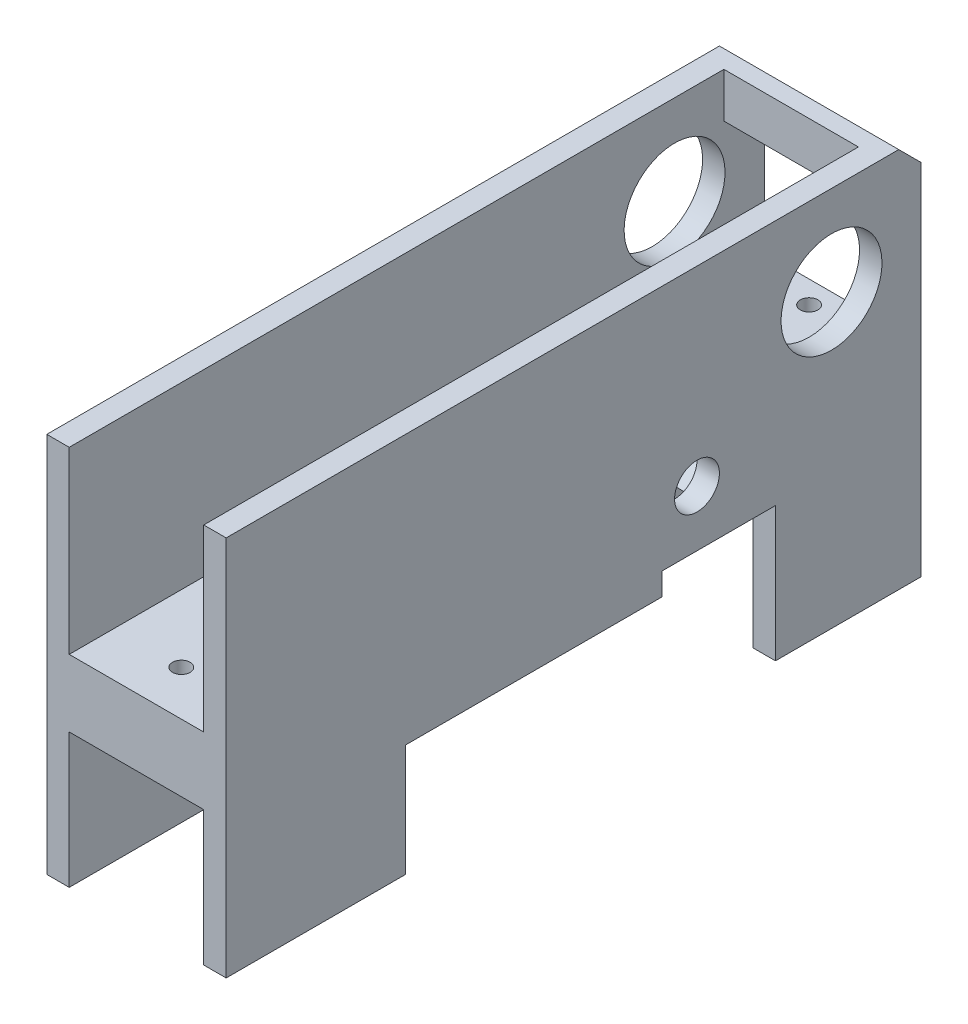
from build123d import *

# Parameters (mm, degrees)
BOSS_EXTRUDE1_DEPTH = 25.4
SKETCH2_R           = 14.2875
CUT_EXTRUDE1_DEPTH  = 83.854726027
SKETCH3_W           = 50.8
SKETCH3_H           = 38.1
CUT_EXTRUDE3_DEPTH  = 9.525
SKETCH4_W           = 11.43
SKETCH4_H           = 12.7
BOSS_EXTRUDE2_DEPTH = 38.1
CHAMFER1_SIZE       = 6.35
SKETCH5_W           = 6.35
SKETCH5_H           = 69.85
BOSS_EXTRUDE3_DEPTH = 95.25
SKETCH7_R           = 6.35
CUT_EXTRUDE5_DEPTH  = 145.139405178
SKETCH8_W           = 38.1
SKETCH8_H           = 9.525
CUT_EXTRUDE6_DEPTH  = 9.525
CHAMFER4_SIZE       = 9.525
SKETCH10_W          = 50.8
SKETCH10_H          = 72.641150816
BOSS_EXTRUDE5_DEPTH = 6.35
BOSS_EXTRUDE9_DEPTH = 50.8
SKETCH13_W          = 38.1
SKETCH13_H          = 50.8
CUT_EXTRUDE8_DEPTH  = 6.3754
SKETCH14_R          = 2.4892
CUT_EXTRUDE9_DEPTH  = 19.05
SKETCH15_R          = 2.4892
CUT_EXTRUDE10_DEPTH = 19.0246


with BuildPart() as part:
    # Sketch1 → Boss-Extrude1 (new, symmetric)
    with BuildSketch(Plane.XY):
        Polygon((-25.4, -47.625), (-19.05, -47.625), (-19.05, -9.525), (19.05, -9.525), (19.05, -47.625), (25.4, -47.625), (25.4, 60.325), (19.05, 60.325), (19.05, 9.525), (-19.05, 9.525), (-19.05, 60.325), (-25.4, 60.325), align=None)
    extrude(amount=BOSS_EXTRUDE1_DEPTH, both=True)

    # Sketch2 → Cut-Extrude1 (cut, through all)
    with BuildSketch(Plane.ZY.offset(25.4)):
        with Locations(Location((0, 34.925, 0), (0, 0, 270))):
            Circle(SKETCH2_R)
    extrude(amount=-CUT_EXTRUDE1_DEPTH, mode=Mode.SUBTRACT)

    # Sketch3 → Cut-Extrude3 (cut)
    with BuildSketch(Plane(origin=(0, 0, 25.4), x_dir=(-1, 0, 0), z_dir=(0, 0, -1))):
        with Locations((0, -28.575)):
            Rectangle(SKETCH3_W, SKETCH3_H)
    extrude(amount=CUT_EXTRUDE3_DEPTH, mode=Mode.SUBTRACT)

    # Sketch4 → Boss-Extrude2 (add)
    with BuildSketch(Plane.ZY.offset(-19.05)):
        with Locations((-19.685, 53.975)):
            Rectangle(SKETCH4_W, SKETCH4_H)
    extrude(amount=BOSS_EXTRUDE2_DEPTH)

    # Chamfer1
    chamfer1_edges = [part.edges().sort_by_distance(p)[0] for p in [
        (0, 60.325, -25.4),
    ]]
    chamfer(chamfer1_edges, length=CHAMFER1_SIZE)

    # Sketch5 → Boss-Extrude3 (add)
    with BuildSketch(Plane.XY.offset(25.4)):
        with Locations((-22.225, 25.4)):
            Rectangle(SKETCH5_W, SKETCH5_H)
        with Locations((22.225, 25.4)):
            Rectangle(SKETCH5_W, SKETCH5_H)
    extrude(amount=BOSS_EXTRUDE3_DEPTH)

    # Sketch7 → Cut-Extrude5 (cut, through all)
    with BuildSketch(Plane.ZY.offset(25.4)):
        with Locations(Location((38.1, 6.35, 0), (0, 0, 270))):
            Circle(SKETCH7_R)
    extrude(amount=-CUT_EXTRUDE5_DEPTH, mode=Mode.SUBTRACT)

    # Sketch8 → Cut-Extrude6 (cut)
    with BuildSketch(Plane.XY.offset(25.4)):
        with Locations((0, 4.7625)):
            Rectangle(SKETCH8_W, SKETCH8_H)
    extrude(amount=-CUT_EXTRUDE6_DEPTH, mode=Mode.SUBTRACT)

    # Chamfer4
    chamfer4_edges = [part.edges().sort_by_distance(p)[0] for p in [
        (0, 0, 25.4),
    ]]
    chamfer(chamfer4_edges, length=CHAMFER4_SIZE - 0.0001)  # a hair under: the kernel refuses the full size

    # Sketch10 → Boss-Extrude5 (add)
    with BuildSketch(Plane.XZ.offset(9.525)):
        with Locations((0, 84.329424592)):
            Rectangle(SKETCH10_W, SKETCH10_H)
    extrude(amount=BOSS_EXTRUDE5_DEPTH)

    # Sketch12 → Boss-Extrude9 (add)
    with BuildSketch(Plane.XY.offset(120.65)):
        Polygon((-25.4, 60.325), (-19.05, 60.325), (-19.05, 9.525), (19.05, 9.525), (19.05, 60.325), (25.4, 60.325), (25.4, -47.625), (19.05, -47.625), (19.05, -15.875), (-19.05, -15.875), (-19.05, -47.625), (-25.4, -47.625), align=None)
    extrude(amount=BOSS_EXTRUDE9_DEPTH)

    # Sketch13 → Cut-Extrude8 (cut)
    with BuildSketch(Plane(origin=(0, -15.875, 0), x_dir=(-1, 0, 0), z_dir=(0, -1, 0))):
        with Locations((0, -146.05)):
            Rectangle(SKETCH13_W, SKETCH13_H)
    extrude(amount=-CUT_EXTRUDE8_DEPTH, mode=Mode.SUBTRACT)

    # Sketch14 → Cut-Extrude9 (cut)
    with BuildSketch(Plane.XZ.offset(9.525)):
        with Locations(Location((0, -19.05, 0), (0, 0, 270))):
            Circle(SKETCH14_R)
        with Locations(Location((0, 6.35, 0), (0, 0, 270))):
            Circle(SKETCH14_R)
    extrude(amount=-CUT_EXTRUDE9_DEPTH, mode=Mode.SUBTRACT)

    # Sketch15 → Cut-Extrude10 (cut)
    with BuildSketch(Plane.XZ.offset(9.4996)):
        with Locations(Location((0, 158.75, 0), (0, 0, 270))):
            Circle(SKETCH15_R)
        with Locations(Location((0, 133.35, 0), (0, 0, 270))):
            Circle(SKETCH15_R)
    extrude(amount=-CUT_EXTRUDE10_DEPTH, mode=Mode.SUBTRACT)


solid = part.part
